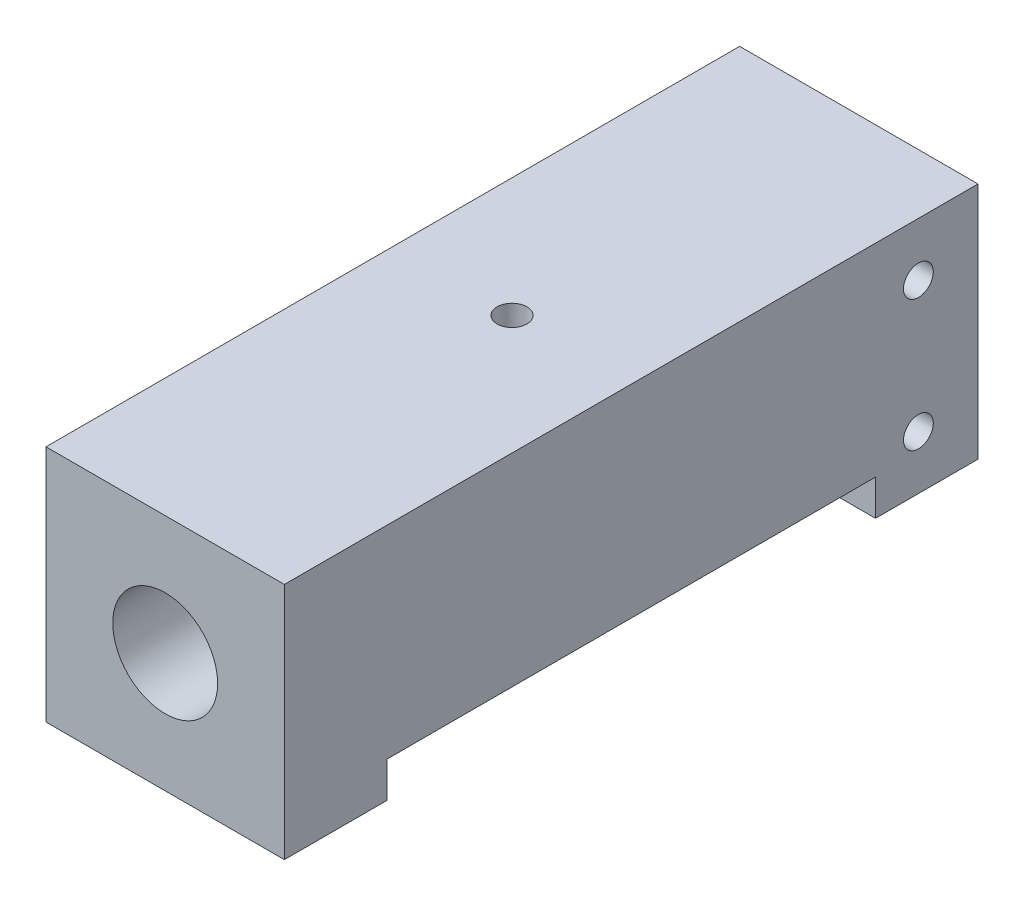
from build123d import *

# Parameters (mm, degrees)
SCHIZZO1_W                   = 20
SCHIZZO1_H                   = 20
ESTRUSIONE_ESTRUSIONE1_DEPTH = 58.2
SCHIZZO2_R                   = 3
TAGLIO_ESTRUSIONE1_DEPTH     = 60.893572276
FORO_FILETTATO_G1_8_1_D      = 8.8
FORO_FILETTATO_G1_8_1_DEPTH  = 10
FORO_FILETTATO_G1_8_1_TIP    = 2.643786724
M3_TAPPED_HOLE2_D            = 2.5
M3_TAPPED_HOLE2_DEPTH        = 5
M3_TAPPED_HOLE2_TIP          = 0.751075774
M3_TAPPED_HOLE3_D            = 2.5
SKETCH1_W                    = 36.2
SKETCH1_H                    = 6
BOSS_EXTRUDE1_DEPTH          = 4.9
CUT_EXTRUDE1_DEPTH           = 65.087830449


with BuildPart() as part:
    # Schizzo1 → Estrusione-Estrusione1 (new body)
    with BuildSketch(Plane.XY):
        Rectangle(SCHIZZO1_W, SCHIZZO1_H)
    extrude(amount=-ESTRUSIONE_ESTRUSIONE1_DEPTH)

    # Schizzo2 → Taglio-Estrusione1 (cut, through all)
    with BuildSketch(Plane(origin=(0, 0, -58.2), x_dir=(-1, 0, 0), z_dir=(0, 0, -1))):
        Circle(SCHIZZO2_R)
    extrude(amount=-TAGLIO_ESTRUSIONE1_DEPTH, mode=Mode.SUBTRACT)

    # Foro filettato G1/8-1
    with Locations(Plane.XY):
        with Locations((0, 0)):
            Hole(FORO_FILETTATO_G1_8_1_D / 2, depth=FORO_FILETTATO_G1_8_1_DEPTH)
            with Locations((0, 0, -(FORO_FILETTATO_G1_8_1_DEPTH + FORO_FILETTATO_G1_8_1_TIP / 2))):  # 118° drill point
                Cone(0, FORO_FILETTATO_G1_8_1_D / 2, FORO_FILETTATO_G1_8_1_TIP, mode=Mode.SUBTRACT)

    # M3 Tapped Hole2
    with Locations(Plane(origin=(0, 10, -29.1), x_dir=(1, 0, 0), z_dir=(0, 1, 0))):
        with Locations((0, 0)):
            Hole(M3_TAPPED_HOLE2_D / 2, depth=M3_TAPPED_HOLE2_DEPTH)
            with Locations((0, 0, -(M3_TAPPED_HOLE2_DEPTH + M3_TAPPED_HOLE2_TIP / 2))):  # 118° drill point
                Cone(0, M3_TAPPED_HOLE2_D / 2, M3_TAPPED_HOLE2_TIP, mode=Mode.SUBTRACT)

    # Schizzo14 → Foro Ø16.0 (16)-1 (revolve, cut)
    with BuildSketch(Plane(origin=(0, 0, -58.2), x_dir=(0, 1, 0), z_dir=(1, 0, 0))):
        Polygon((0, 0), (0, 16.806884952), (8, 12), (8, 0), align=None)
    revolve(axis=Axis((0, 0, -64.55), (0, 0, 1)), mode=Mode.SUBTRACT)

    # M3 Tapped Hole3 (through all)
    with Locations(Plane(origin=(10, 5.5, -53.2), x_dir=(0, 0, 1), z_dir=(1, 0, 0))):
        with Locations((0, 0), (0, 11)):
            Hole(M3_TAPPED_HOLE3_D / 2)

    # Sketch1 → Boss-Extrude1 (add)
    with BuildSketch(Plane.ZY.offset(10)):
        with Locations((-40.1, 0)):
            Rectangle(SKETCH1_W, SKETCH1_H)
    extrude(amount=BOSS_EXTRUDE1_DEPTH)

    # Sketch2 → Cut-Extrude1 (cut, through all)
    with BuildSketch(Plane(origin=(10, 0, 0), x_dir=(0, 0, -1), z_dir=(1, 0, 0))):
        Polygon((49.6, -10), (33.6, -10), (8.6, -10), (8.6, -7), (33.6, -7), (49.6, -7), align=None)
    extrude(amount=-CUT_EXTRUDE1_DEPTH, mode=Mode.SUBTRACT)


solid = part.part
